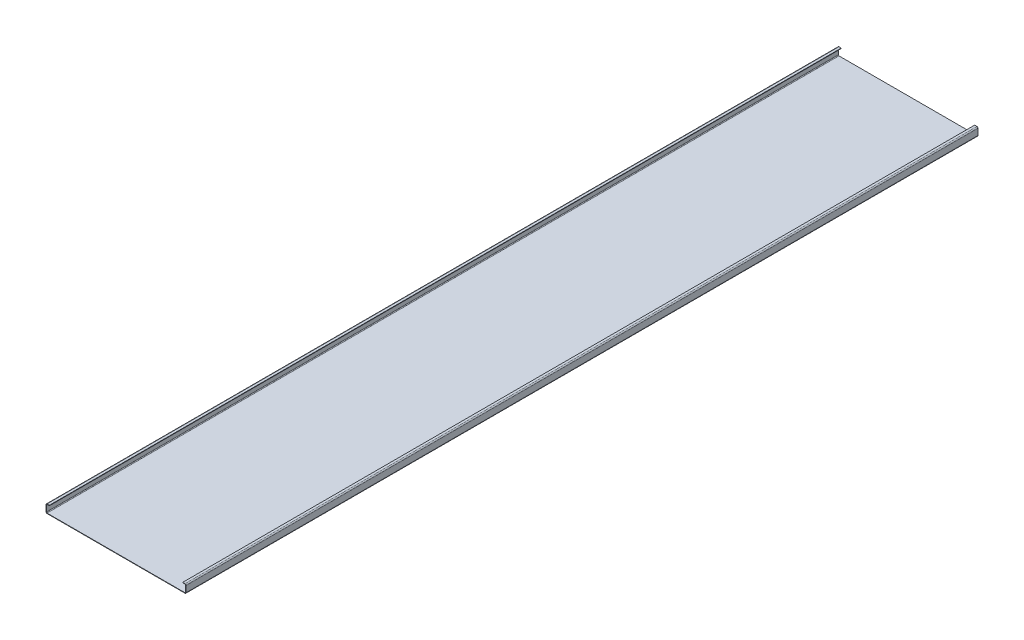
from build123d import *

# Parameters (mm, degrees)
BASE_FLANGE1_DEPTH = 2380


# Sheet-metal steps are written as plain solids
with BuildPart() as part:
    # Sketch1 → Base-Flange1 (new body)
    with BuildSketch(Plane.XY):
        with BuildLine():
            Line((10, 25), (3.25, 25))
            ThreePointArc((3.25, 25), (0.951902961, 24.048097039), (0, 21.75))
            Line((0, 21.75), (0, 3.25))
            ThreePointArc((0, 3.25), (0.951902961, 0.951902961), (3.25, 0))
            Line((3.25, 0), (417.75, 0))
            ThreePointArc((417.75, 0), (420.048097039, 0.951902961), (421, 3.25))
            Line((421, 3.25), (421, 21.75))
            ThreePointArc((421, 21.75), (420.048097039, 24.048097039), (417.75, 25))
            Line((417.75, 25), (411, 25))
            Line((411, 25), (411, 23.75))
            Line((411, 23.75), (417.75, 23.75))
            ThreePointArc((417.75, 23.75), (419.164213562, 23.164213562), (419.75, 21.75))
            Line((419.75, 21.75), (419.75, 3.25))
            ThreePointArc((419.75, 3.25), (419.164213562, 1.835786438), (417.75, 1.25))
            Line((417.75, 1.25), (3.25, 1.25))
            ThreePointArc((3.25, 1.25), (1.835786438, 1.835786438), (1.25, 3.25))
            Line((1.25, 3.25), (1.25, 21.75))
            ThreePointArc((1.25, 21.75), (1.835786438, 23.164213562), (3.25, 23.75))
            Line((3.25, 23.75), (10, 23.75))
            Line((10, 23.75), (10, 25))
        make_face()
    extrude(amount=BASE_FLANGE1_DEPTH)


solid = part.part
